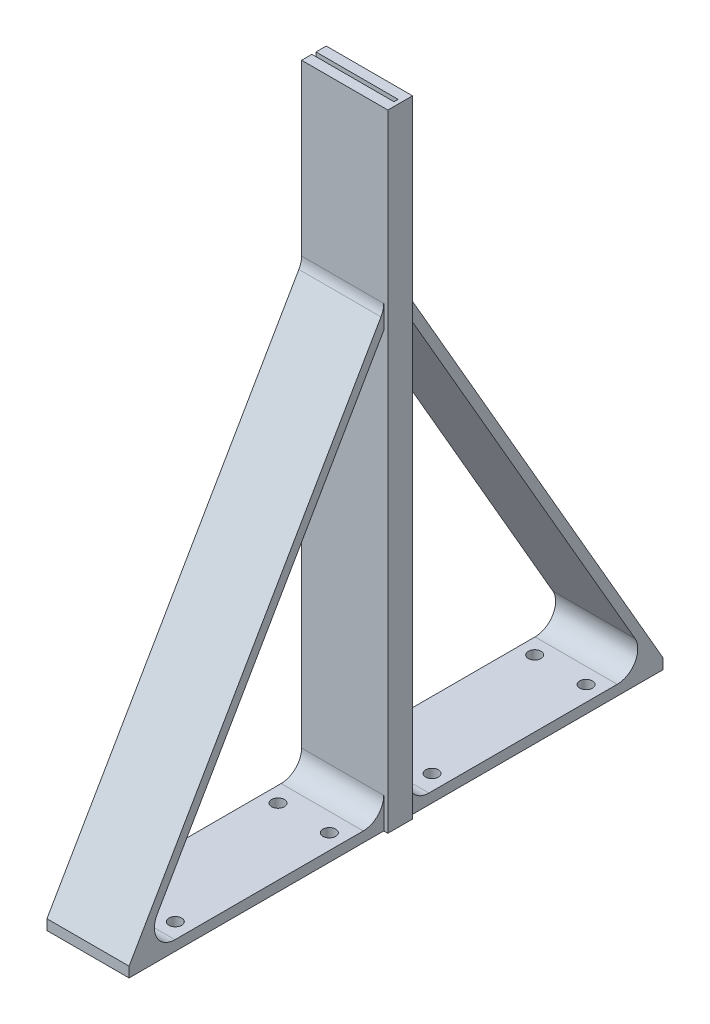
from build123d import *

# Parameters (mm, degrees)
SKETCH_1_W           = 40
SKETCH_1_H           = 260
SKETCH_1_R           = 3.1
EXTRUDE_1_DEPTH      = 5
SKETCH_2_W           = 40
SKETCH_2_H           = 5
EXTRUDE_2_DEPTH      = 300
EXTRUDE_3_DEPTH      = 20
EXTRUDE_3_DEPTH_BACK = 20
SKETCH_6_W           = 12
SKETCH_6_H           = 305
EXTRUDE_4_DEPTH      = 2
FILLET_1_R           = 10


with BuildPart() as part:
    # 草图1 → 凸台-拉伸1 (new body)
    with BuildSketch(Plane(origin=(0, 0, 0), x_dir=(1, 0, 0), z_dir=(0, 1, 0))):
        Rectangle(SKETCH_1_W, SKETCH_1_H)
        with Locations((-12.5, 100)):
            Circle(SKETCH_1_R, mode=Mode.SUBTRACT)
        with Locations((12.5, 100)):
            Circle(SKETCH_1_R, mode=Mode.SUBTRACT)
        with Locations((12.5, -100)):
            Circle(SKETCH_1_R, mode=Mode.SUBTRACT)
        with Locations((-12.5, -100)):
            Circle(SKETCH_1_R, mode=Mode.SUBTRACT)
        with Locations((-12.5, 25)):
            Circle(SKETCH_1_R, mode=Mode.SUBTRACT)
        with Locations((12.5, 25)):
            Circle(SKETCH_1_R, mode=Mode.SUBTRACT)
        with Locations((12.5, -25)):
            Circle(SKETCH_1_R, mode=Mode.SUBTRACT)
        with Locations((-12.5, -25)):
            Circle(SKETCH_1_R, mode=Mode.SUBTRACT)
    extrude(amount=EXTRUDE_1_DEPTH)

    # 草图2 → 凸台-拉伸2 (add)
    with BuildSketch(Plane(origin=(0, 5, 0), x_dir=(1, 0, 0), z_dir=(0, 1, 0))):
        with Locations((0, 3.5)):
            Rectangle(SKETCH_2_W, SKETCH_2_H)
        with Locations((0, -3.5)):
            Rectangle(SKETCH_2_W, SKETCH_2_H)
    extrude(amount=EXTRUDE_2_DEPTH)

    # 草图3 → 凸台-拉伸3 (add, two sides: drawn at the far end of the back side and taken through both)
    with BuildSketch(Plane(origin=(0, 0, 0), x_dir=(0, 0, -1), z_dir=(1, 0, 0)).offset(-EXTRUDE_3_DEPTH_BACK)):
        Polygon((-6, 211.114046101), (-125, 5), (-130, 5), (-6, 219.774300139), align=None)
        Polygon((6, 219.774300139), (6, 211.114046101), (125, 5), (130, 5), align=None)
    extrude(amount=EXTRUDE_3_DEPTH + EXTRUDE_3_DEPTH_BACK)

    # 草图6 → 凸台-拉伸4 (add)
    with BuildSketch(Plane(origin=(20, 0, 0), x_dir=(0, 0, -1), z_dir=(1, 0, 0))):
        with Locations((0, 152.5)):
            Rectangle(SKETCH_6_W, SKETCH_6_H)
    extrude(amount=EXTRUDE_4_DEPTH)

    # 圆角1
    fillet_1_edges = [part.edges().sort_by_distance(p)[0] for p in [
        (0, 219.774300139, 6),
        (0, 219.774300139, -6),
        (0, 5, 6),
        (0, 5, -6),
        (0, 5, 125),
        (0, 5, -125),
    ]]
    fillet(fillet_1_edges, radius=FILLET_1_R)


solid = part.part
